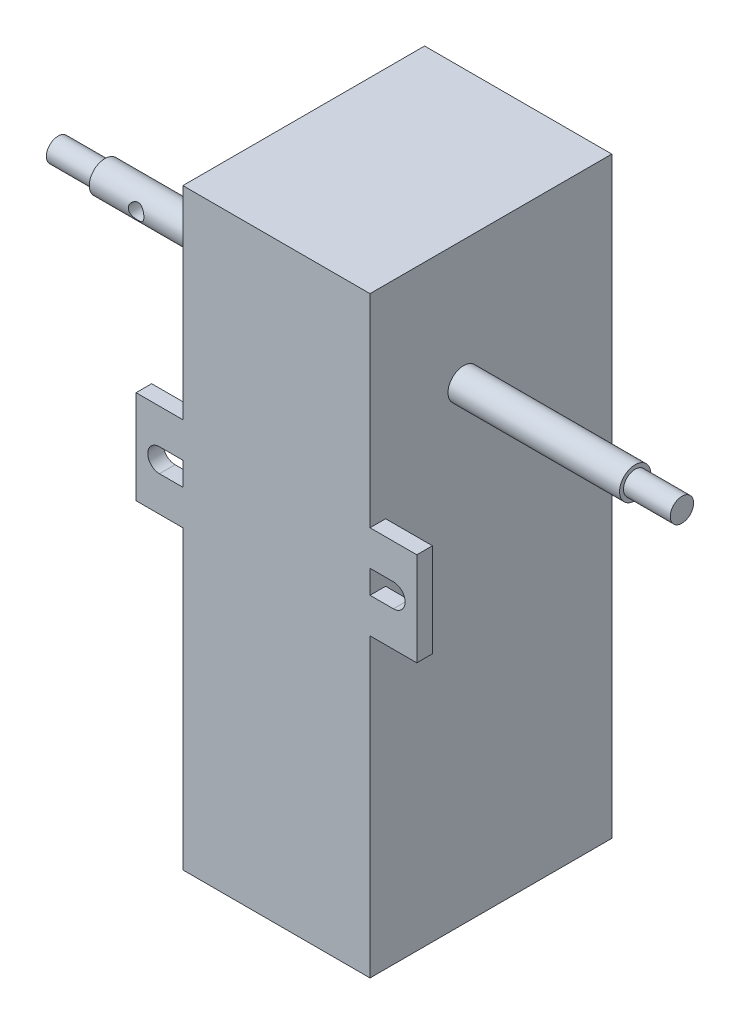
from build123d import *

# Parameters (mm, degrees)
SKETCH1_W                = 24
SKETCH1_H                = 31
BOSS_EXTRUDE1_DEPTH      = 76
BOSS_EXTRUDE2_DEPTH      = 28
BOSS_EXTRUDE2_DEPTH_BACK = 52
SKETCH2_R                = 2
SKETCH7_R                = 2
SKETCH7_R_2              = 1.5
CUT_EXTRUDE1_DEPTH       = 6
SKETCH17_R               = 1
CUT_EXTRUDE3_DEPTH       = 88.271129247
SKETCH18_W               = 2
SKETCH18_H               = 12
BOSS_EXTRUDE3_DEPTH      = 6
CUT_EXTRUDE4_REACH       = 93.307


with BuildPart() as part:
    # Sketch1 → Boss-Extrude1 (new body)
    with BuildSketch(Plane(origin=(0, 0, 0), x_dir=(1, 0, 0), z_dir=(0, 1, 0))):
        Rectangle(SKETCH1_W, SKETCH1_H)
    extrude(amount=BOSS_EXTRUDE1_DEPTH)

    # Sketch2 → Boss-Extrude2 (add, two sides: drawn at the far end of the back side and taken through both)
    with BuildSketch(Plane(origin=(12, 0, 0), x_dir=(0, 0, -1), z_dir=(1, 0, 0)).offset(-BOSS_EXTRUDE2_DEPTH_BACK)):
        with Locations((-3.5, 60)):
            Circle(SKETCH2_R)
    extrude(amount=BOSS_EXTRUDE2_DEPTH + BOSS_EXTRUDE2_DEPTH_BACK)

    # Sketch7 → Cut-Extrude1 (cut)
    with BuildSketch(Plane.ZY.offset(40)):
        with Locations((3.5, 60)):
            Circle(SKETCH7_R)
        with Locations((3.5, 60)):
            Circle(SKETCH7_R_2, mode=Mode.SUBTRACT)
    cut_extrude1 = extrude(amount=-CUT_EXTRUDE1_DEPTH, mode=Mode.SUBTRACT)

    # Sketch17 → Cut-Extrude3 (cut, through all)
    with BuildSketch(Plane.XY):
        with Locations((-28, 60)):
            Circle(SKETCH17_R)
    extrude(amount=CUT_EXTRUDE3_DEPTH, mode=Mode.SUBTRACT)

    # Mirror7: Cut-Extrude1 across plane
    add(cut_extrude1.mirror(Plane(origin=(0, 0, 0), x_dir=(0, 0, 1), z_dir=(1, 0, 0))), mode=Mode.SUBTRACT)

    # Sketch18 → Boss-Extrude3 (add)
    with BuildSketch(Plane(origin=(12, 0, 0), x_dir=(0, 0, -1), z_dir=(1, 0, 0))):
        with Locations((-14.5, 44)):
            Rectangle(SKETCH18_W, SKETCH18_H)
    boss_extrude3 = extrude(amount=BOSS_EXTRUDE3_DEPTH)

    # Sketch19 → Cut-Extrude4 (cut, up to next)
    with BuildSketch(Plane.XY.offset(15.5), mode=Mode.PRIVATE) as cut_extrude4_sk1:
        with BuildLine():
            Line((12, 45.5), (15, 45.5))
            ThreePointArc((15, 45.5), (16.5, 44), (15, 42.5))
            Line((15, 42.5), (12, 42.5))
            Line((12, 42.5), (12, 45.5))
        make_face()
    cut_extrude4_tool1 = extrude(cut_extrude4_sk1.sketch, amount=-CUT_EXTRUDE4_REACH, mode=Mode.PRIVATE) & part.part
    cut_extrude4 = cut_extrude4_tool1.solids().sort_by_distance((14.102462, 44, 15.5))[0]
    add(cut_extrude4, mode=Mode.SUBTRACT)

    # Mirror8: Boss-Extrude3, Cut-Extrude4 across plane
    add(boss_extrude3.mirror(Plane(origin=(0, 0, 0), x_dir=(0, 0, 1), z_dir=(1, 0, 0))))
    add(cut_extrude4.mirror(Plane(origin=(0, 0, 0), x_dir=(0, 0, 1), z_dir=(1, 0, 0))), mode=Mode.SUBTRACT)


solid = part.part
